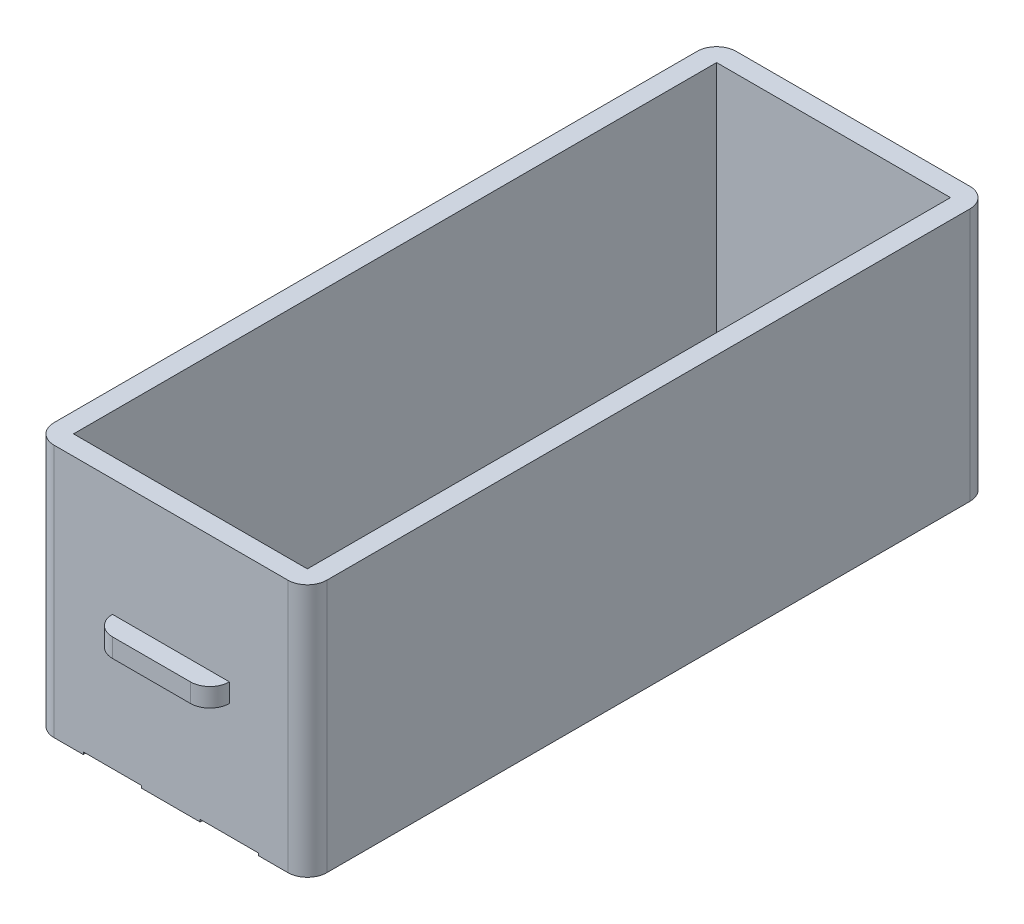
from build123d import *

# Parameters (mm, degrees)
SKETCH1_W           = 88.9
SKETCH1_H           = 82.55
BOSS_EXTRUDE1_DEPTH = 111.125
SKETCH2_W           = 76.2
SKETCH2_H           = 209.55
CUT_EXTRUDE1_DEPTH  = 76.2
SKETCH3_W           = 38.1
SKETCH3_H           = 6.096
BOSS_EXTRUDE2_DEPTH = 6.35
SKETCH4_W           = 19.05
SKETCH4_H           = 0.762
CUT_EXTRUDE2_DEPTH  = 231.379015158
FILLET1_R           = 6.35
FILLET2_R           = 6.35


with BuildPart() as part:
    # Sketch1 → Boss-Extrude1 (new, symmetric)
    with BuildSketch(Plane.XY):
        Rectangle(SKETCH1_W, SKETCH1_H)
    extrude(amount=BOSS_EXTRUDE1_DEPTH, both=True)

    # Sketch2 → Cut-Extrude1 (cut)
    with BuildSketch(Plane(origin=(0, 41.275, 0), x_dir=(1, 0, 0), z_dir=(0, 1, 0))):
        Rectangle(SKETCH2_W, SKETCH2_H)
    extrude(amount=-CUT_EXTRUDE1_DEPTH, mode=Mode.SUBTRACT)

    # Sketch3 → Boss-Extrude2 (add, symmetric)
    with BuildSketch(Plane.XY.offset(111.125)):
        Rectangle(SKETCH3_W, SKETCH3_H)
    extrude(amount=BOSS_EXTRUDE2_DEPTH, both=True)

    # Sketch4 → Cut-Extrude2 (cut, through all)
    with BuildSketch(Plane.XY.offset(111.125)):
        with Locations((-19.05, -40.894)):
            Rectangle(SKETCH4_W, SKETCH4_H)
        with Locations((19.05, -40.894)):
            Rectangle(SKETCH4_W, SKETCH4_H)
    extrude(amount=-CUT_EXTRUDE2_DEPTH, mode=Mode.SUBTRACT)

    # Fillet1
    fillet1_edges = [part.edges().sort_by_distance(p)[0] for p in [
        (44.45, 0, 111.125),
        (44.45, 0, -111.125),
        (-44.45, 0, -111.125),
        (-44.45, 0, 111.125),
    ]]
    fillet(fillet1_edges, radius=FILLET1_R)

    # Fillet2
    fillet2_edges = [part.edges().sort_by_distance(p)[0] for p in [
        (19.05, 0, 117.475),
        (-19.05, 0, 117.475),
    ]]
    fillet(fillet2_edges, radius=FILLET2_R - 0.0001)  # a hair under: the kernel refuses the full size


solid = part.part
